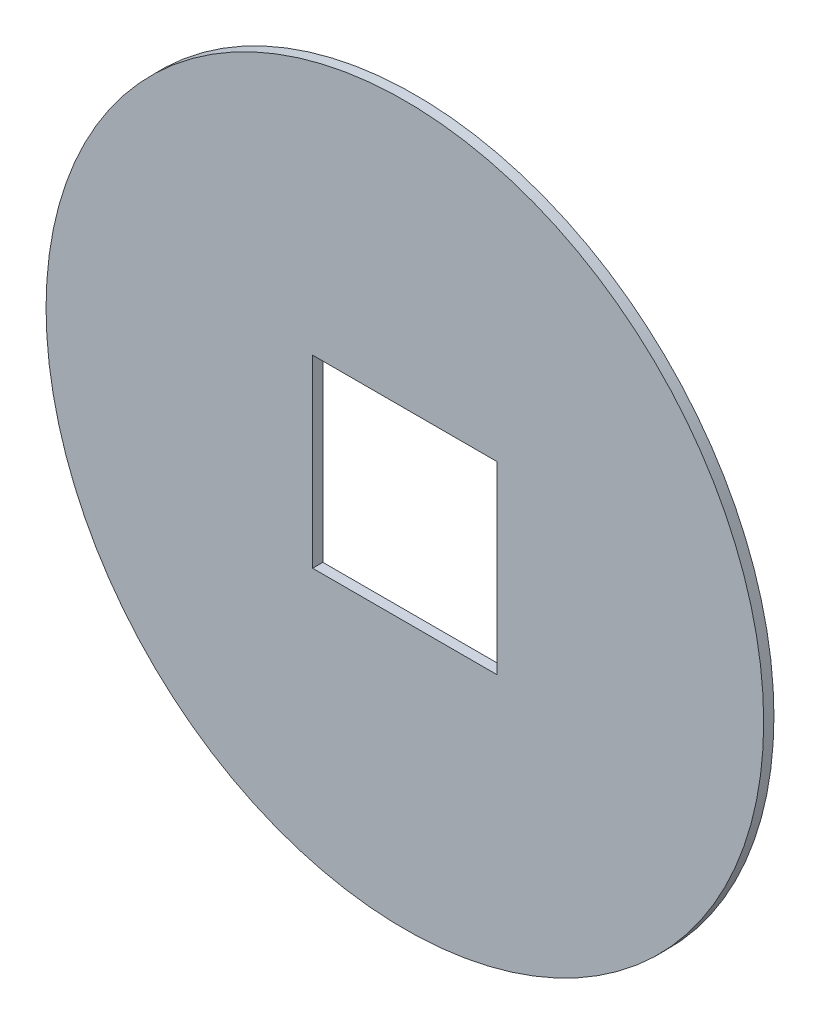
from build123d import *

# Parameters (mm, degrees)
ESQUISSE1_R        = 175
ESQUISSE1_W        = 90
ESQUISSE1_H        = 90
BOSS_EXTRU_1_DEPTH = 5


with BuildPart() as part:
    # Esquisse1 → Boss.-Extru.1 (new body)
    with BuildSketch(Plane.XY):
        Circle(ESQUISSE1_R)
        Rectangle(ESQUISSE1_W, ESQUISSE1_H, mode=Mode.SUBTRACT)
    extrude(amount=BOSS_EXTRU_1_DEPTH)


solid = part.part
